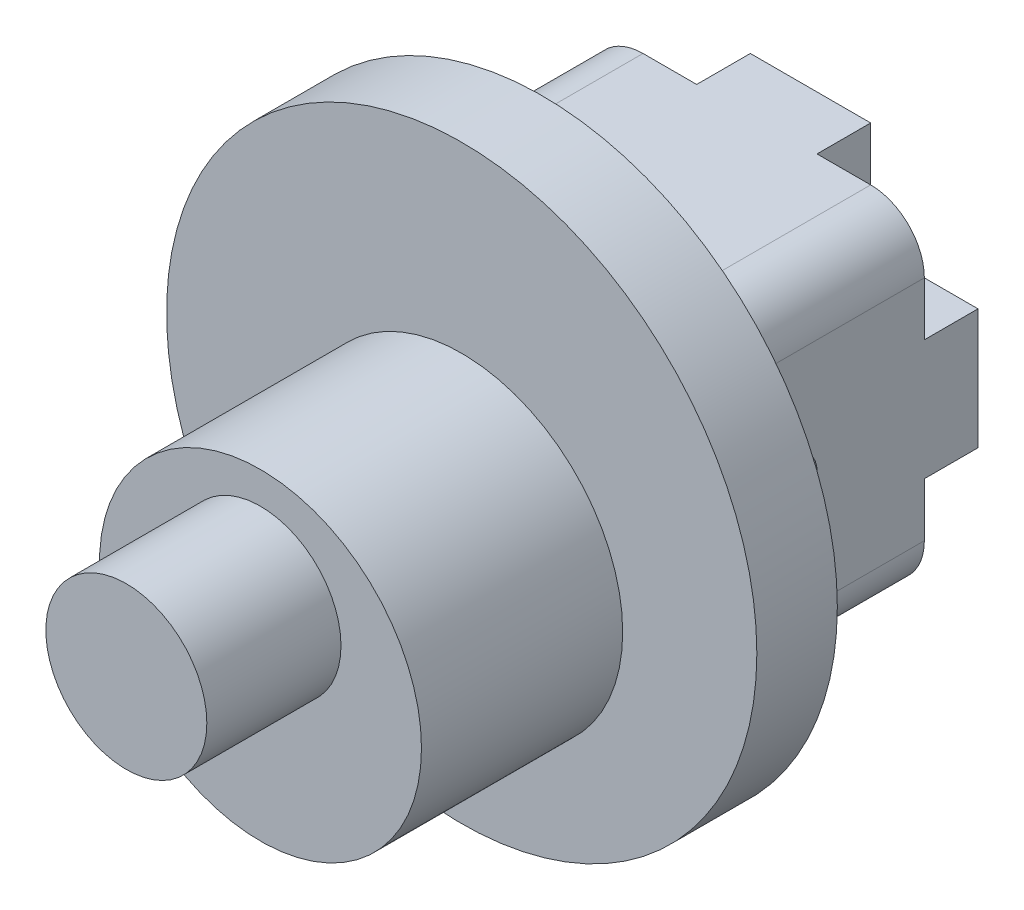
from build123d import *

# Parameters (mm, degrees)
BOSS_EXTRUDE1_DEPTH = 2
SKETCH3_R           = 11
BOSS_EXTRUDE3_DEPTH = 3
SKETCH4_R           = 6
BOSS_EXTRUDE4_DEPTH = 7.5
SKETCH5_R           = 3
BOSS_EXTRUDE5_DEPTH = 5
BOSS_EXTRUDE6_START = 2
BOSS_EXTRUDE6_DEPTH = 8
SKETCH7_R           = 1
CUT_EXTRUDE2_DEPTH  = 15


with BuildPart() as part:
    # Sketch1 → Boss-Extrude1 (new body)
    with BuildSketch(Plane.XY):
        with BuildLine():
            Line((2.242640687, 4.242640687), (2.242640687, 6.242640687))
            Line((2.242640687, 6.242640687), (-2.242640687, 6.242640687))
            Line((-2.242640687, 6.242640687), (-2.242640687, 4.242640687))
            ThreePointArc((-2.242640687, 4.242640687), (-2.828427125, 2.828427125), (-4.242640687, 2.242640687))
            Line((-4.242640687, 2.242640687), (-6.242640687, 2.242640687))
            Line((-6.242640687, 2.242640687), (-6.242640687, -2.242640687))
            Line((-6.242640687, -2.242640687), (-4.242640687, -2.242640687))
            ThreePointArc((-4.242640687, -2.242640687), (-2.828427125, -2.828427125), (-2.242640687, -4.242640687))
            Line((-2.242640687, -4.242640687), (-2.242640687, -6.242640687))
            Line((-2.242640687, -6.242640687), (2.242640687, -6.242640687))
            Line((2.242640687, -6.242640687), (2.242640687, -4.242640687))
            ThreePointArc((2.242640687, -4.242640687), (2.828427125, -2.828427125), (4.242640687, -2.242640687))
            Line((4.242640687, -2.242640687), (6.242640687, -2.242640687))
            Line((6.242640687, -2.242640687), (6.242640687, 2.242640687))
            Line((6.242640687, 2.242640687), (4.242640687, 2.242640687))
            ThreePointArc((4.242640687, 2.242640687), (2.828427125, 2.828427125), (2.242640687, 4.242640687))
        make_face()
    extrude(amount=BOSS_EXTRUDE1_DEPTH)



with BuildPart() as body_2:
    # Sketch3 → Boss-Extrude3 (new body)
    with BuildSketch(Plane.XY.offset(10)):
        Circle(SKETCH3_R)
    extrude(amount=BOSS_EXTRUDE3_DEPTH)


with BuildPart() as body_3:
    # Sketch4 → Boss-Extrude4 (new body)
    with BuildSketch(Plane.XY.offset(13)):
        with Locations((0, -1.812)):
            Circle(SKETCH4_R)
    extrude(amount=BOSS_EXTRUDE4_DEPTH)


with BuildPart() as body_4:
    # Sketch5 → Boss-Extrude5 (new body)
    with BuildSketch(Plane.XY.offset(20.5)):
        Circle(SKETCH5_R)
    extrude(amount=BOSS_EXTRUDE5_DEPTH)


with BuildPart() as part_1:
    add(part.part)

    add(body_2.part)  # Boss-Extrude6 merges body 2
    # Sketch1<4> → Boss-Extrude6 (add)
    with BuildSketch(Plane.XY.offset(BOSS_EXTRUDE6_START)):
        with BuildLine():
            Line((4.242640687, 6.242640687), (-4.242640687, 6.242640687))
            ThreePointArc((-4.242640687, 6.242640687), (-5.656854249, 5.656854249), (-6.242640687, 4.242640687))
            Line((-6.242640687, 4.242640687), (-6.242640687, -4.242640687))
            ThreePointArc((-6.242640687, -4.242640687), (-5.656854249, -5.656854249), (-4.242640687, -6.242640687))
            Line((-4.242640687, -6.242640687), (4.242640687, -6.242640687))
            ThreePointArc((4.242640687, -6.242640687), (5.656854249, -5.656854249), (6.242640687, -4.242640687))
            Line((6.242640687, -4.242640687), (6.242640687, 4.242640687))
            ThreePointArc((6.242640687, 4.242640687), (5.656854249, 5.656854249), (4.242640687, 6.242640687))
        make_face()
    extrude(amount=BOSS_EXTRUDE6_DEPTH)

    # Sketch7 → Cut-Extrude2 (cut)
    with BuildSketch(Plane(origin=(6.242640687, 0, 0), x_dir=(0, 0, -1), z_dir=(1, 0, 0))):
        with Locations((-7, 0)):
            Circle(SKETCH7_R)
    extrude(amount=-CUT_EXTRUDE2_DEPTH, mode=Mode.SUBTRACT)


solid = Compound([body_3.part, body_4.part, part_1.part])
